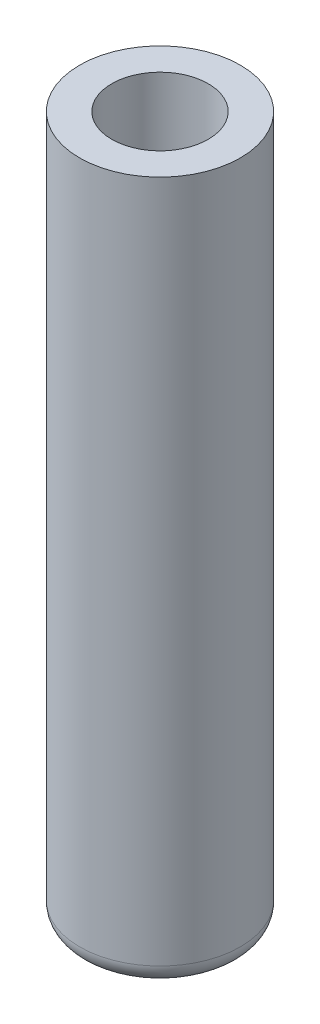
from build123d import *

# Parameters (mm, degrees)
SKETCH_1_R      = 4
SKETCH_1_R_2    = 2.4
EXTRUDE_1_DEPTH = 35
FILLET_1_R      = 1


with BuildPart() as part:
    # 草图1 → 凸台-拉伸1 (new body)
    with BuildSketch(Plane(origin=(0, 0, 0), x_dir=(1, 0, 0), z_dir=(0, 1, 0))):
        Circle(SKETCH_1_R)
        Circle(SKETCH_1_R_2, mode=Mode.SUBTRACT)
    extrude(amount=EXTRUDE_1_DEPTH)

    # 圆角1
    fillet_1_edges = [part.edges().sort_by_distance(p)[0] for p in [
        (-4, 0, 0),
    ]]
    fillet(fillet_1_edges, radius=FILLET_1_R)


solid = part.part
